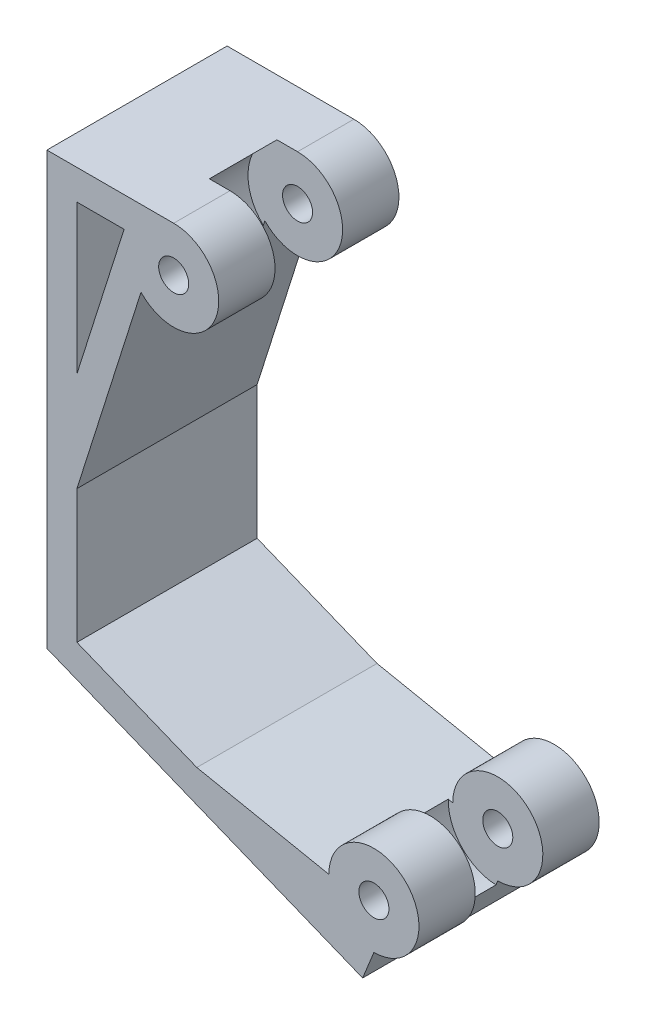
from build123d import *

# Parameters (mm, degrees)
SKETCH1_R               = 1
BOSS_EXTRUDE1_DEPTH     = 12
CUT_EXTRUDE1_DEPTH      = 2.25
CUT_EXTRUDE1_DEPTH_BACK = 2.25
SKETCH2_R               = 3.3


with BuildPart() as part:
    # Sketch1 → Boss-Extrude1 (new body)
    with BuildSketch(Plane.XY):
        with BuildLine():
            Line((0, 6.682242155), (0, 35.422655485))
            Line((0, 35.422655485), (8.44331213, 35.422655485))
            ThreePointArc((8.44331213, 35.422655485), (11.199736218, 31.238541367), (6.26736501, 30.357406316))
            Line((6.26736501, 30.357406316), (2, 16.896168961))
            Line((2, 16.896168961), (2, 8.031259189))
            Line((2, 8.031259189), (9.984810659, 4.805186274))
            Line((9.984810659, 4.805186274), (18.777104728, 3.040790207))
            ThreePointArc((18.777104728, 3.040790207), (23.898425072, 5.162110551), (21.777104728, 0.040790207))
            Line((21.777104728, 0.040790207), (21.027891541, -1.813577502))
            Line((21.027891541, -1.813577502), (0, 6.682242155))
        make_face()
        with Locations((8.44331213, 32.422655485)):
            Circle(SKETCH1_R, mode=Mode.SUBTRACT)
        with Locations((21.777104728, 3.040790207)):
            Circle(SKETCH1_R, mode=Mode.SUBTRACT)
        Polygon((5.140993038, 33.422655485), (2, 33.422655485), (2, 23.514514817), align=None, mode=Mode.SUBTRACT)
    extrude(amount=BOSS_EXTRUDE1_DEPTH)

    # Sketch2 → Cut-Extrude1 (cut, two sides: drawn at the far end of the back side and taken through both)
    with BuildSketch(Plane.XY.offset(6).offset(-CUT_EXTRUDE1_DEPTH_BACK)):
        with Locations((8.44331213, 32.422655485)):
            Circle(SKETCH2_R)
        with Locations((21.777104728, 3.040790207)):
            Circle(SKETCH2_R)
    extrude(amount=CUT_EXTRUDE1_DEPTH + CUT_EXTRUDE1_DEPTH_BACK, mode=Mode.SUBTRACT)


solid = part.part
